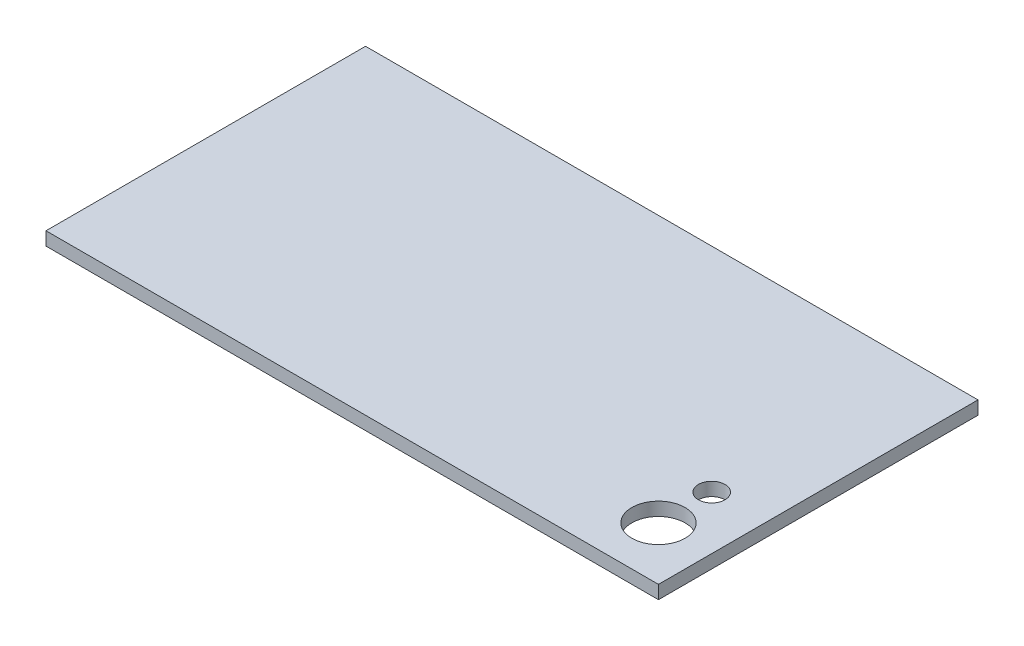
from build123d import *

# Parameters (mm, degrees)
SKETCH1_W           = 146.05
SKETCH1_H           = 76.2
SKETCH1_R           = 6.35
SKETCH1_R_2         = 3.175
BOSS_EXTRUDE1_DEPTH = 3.175


with BuildPart() as part:
    # Sketch1 → Boss-Extrude1 (new body)
    with BuildSketch(Plane(origin=(0, 0, 0), x_dir=(1, 0, 0), z_dir=(0, 1, 0))):
        with Locations((73.025, 38.1)):
            Rectangle(SKETCH1_W, SKETCH1_H)
        with Locations((133.35, 12.7)):
            Circle(SKETCH1_R, mode=Mode.SUBTRACT)
        with Locations((133.35, 25.4)):
            Circle(SKETCH1_R_2, mode=Mode.SUBTRACT)
    extrude(amount=BOSS_EXTRUDE1_DEPTH)


solid = part.part
